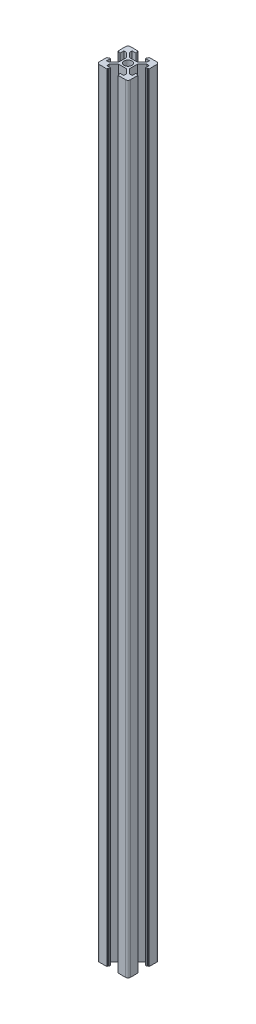
from build123d import *

# Parameters (mm, degrees)
SKETCH_1_R          = 2.5
EXTRUDE_1_DEPTH     = 500
SKETCH_2_R          = 1.75
CUT_EXTRUDE_1_DEPTH = 21


with BuildPart() as part:
    # 草图1 → 凸台-拉伸1 (new body)
    with BuildSketch(Plane(origin=(0, 0, 0), x_dir=(1, 0, 0), z_dir=(0, 1, 0))):
        with BuildLine():
            Line((-5.825824942, 5.993206118), (-5.825824942, 0.914526462))
            Line((-5.825824942, 0.914526462), (-8.786485114, -2.04613371))
            Line((-8.786485114, -2.04613371), (-10.425824942, -2.04613371))
            Line((-10.425824942, -2.04613371), (-10.425824942, 0.35386629))
            Line((-10.425824942, 0.35386629), (-11.425824942, 0.35386629))
            Line((-11.425824942, 0.35386629), (-11.425824942, -0.14613371))
            Line((-11.425824942, -0.14613371), (-12.225824942, -0.14613371))
            Line((-12.225824942, -0.14613371), (-12.225824942, -5.04613371))
            ThreePointArc((-12.225824942, -5.04613371), (-11.786485114, -6.106793882), (-10.725824942, -6.54613371))
            Line((-10.725824942, -6.54613371), (-5.825824942, -6.54613371))
            Line((-5.825824942, -6.54613371), (-5.825824942, -5.74613371))
            Line((-5.825824942, -5.74613371), (-5.325824942, -5.74613371))
            Line((-5.325824942, -5.74613371), (-5.325824942, -4.74613371))
            Line((-5.325824942, -4.74613371), (-7.725824942, -4.74613371))
            Line((-7.725824942, -4.74613371), (-7.725824942, -3.106793882))
            Line((-7.725824942, -3.106793882), (-4.765164771, -0.14613371))
            Line((-4.765164771, -0.14613371), (0.313514886, -0.14613371))
            Line((0.313514886, -0.14613371), (3.274175058, -3.106793882))
            Line((3.274175058, -3.106793882), (3.274175058, -4.74613371))
            Line((3.274175058, -4.74613371), (0.874175058, -4.74613371))
            Line((0.874175058, -4.74613371), (0.874175058, -5.74613371))
            Line((0.874175058, -5.74613371), (1.374175058, -5.74613371))
            Line((1.374175058, -5.74613371), (1.374175058, -6.54613371))
            Line((1.374175058, -6.54613371), (6.274175058, -6.54613371))
            ThreePointArc((6.274175058, -6.54613371), (7.334835229, -6.106793882), (7.774175058, -5.04613371))
            Line((7.774175058, -5.04613371), (7.774175058, -0.14613371))
            Line((7.774175058, -0.14613371), (6.974175058, -0.14613371))
            Line((6.974175058, -0.14613371), (6.974175058, 0.35386629))
            Line((6.974175058, 0.35386629), (5.974175058, 0.35386629))
            Line((5.974175058, 0.35386629), (5.974175058, -2.04613371))
            Line((5.974175058, -2.04613371), (4.334835229, -2.04613371))
            Line((4.334835229, -2.04613371), (1.374175058, 0.914526462))
            Line((1.374175058, 0.914526462), (1.374175058, 5.993206118))
            Line((1.374175058, 5.993206118), (4.334835229, 8.95386629))
            Line((4.334835229, 8.95386629), (5.974175058, 8.95386629))
            Line((5.974175058, 8.95386629), (5.974175058, 6.55386629))
            Line((5.974175058, 6.55386629), (6.974175058, 6.55386629))
            Line((6.974175058, 6.55386629), (6.974175058, 7.05386629))
            Line((6.974175058, 7.05386629), (7.774175058, 7.05386629))
            Line((7.774175058, 7.05386629), (7.774175058, 11.95386629))
            ThreePointArc((7.774175058, 11.95386629), (7.334835229, 13.014526462), (6.274175058, 13.45386629))
            Line((6.274175058, 13.45386629), (1.374175058, 13.45386629))
            Line((1.374175058, 13.45386629), (1.374175058, 12.65386629))
            Line((1.374175058, 12.65386629), (0.874175058, 12.65386629))
            Line((0.874175058, 12.65386629), (0.874175058, 11.65386629))
            Line((0.874175058, 11.65386629), (3.274175058, 11.65386629))
            Line((3.274175058, 11.65386629), (3.274175058, 10.014526462))
            Line((3.274175058, 10.014526462), (0.313514886, 7.05386629))
            Line((0.313514886, 7.05386629), (-4.765164771, 7.05386629))
            Line((-4.765164771, 7.05386629), (-7.725824942, 10.014526462))
            Line((-7.725824942, 10.014526462), (-7.725824942, 11.65386629))
            Line((-7.725824942, 11.65386629), (-5.325824942, 11.65386629))
            Line((-5.325824942, 11.65386629), (-5.325824942, 12.65386629))
            Line((-5.325824942, 12.65386629), (-5.825824942, 12.65386629))
            Line((-5.825824942, 12.65386629), (-5.825824942, 13.45386629))
            Line((-5.825824942, 13.45386629), (-10.725824942, 13.45386629))
            ThreePointArc((-10.725824942, 13.45386629), (-11.786485114, 13.014526462), (-12.225824942, 11.95386629))
            Line((-12.225824942, 11.95386629), (-12.225824942, 7.05386629))
            Line((-12.225824942, 7.05386629), (-11.425824942, 7.05386629))
            Line((-11.425824942, 7.05386629), (-11.425824942, 6.55386629))
            Line((-11.425824942, 6.55386629), (-10.425824942, 6.55386629))
            Line((-10.425824942, 6.55386629), (-10.425824942, 8.95386629))
            Line((-10.425824942, 8.95386629), (-8.786485114, 8.95386629))
            Line((-8.786485114, 8.95386629), (-5.825824942, 5.993206118))
        make_face()
        with Locations((-2.225824942, 3.45386629)):
            Circle(SKETCH_1_R, mode=Mode.SUBTRACT)
    extrude(amount=EXTRUDE_1_DEPTH)

    # 草图2 → 切除-拉伸1 (cut)
    with BuildSketch(Plane(origin=(0, 0, -7.05386629), x_dir=(-1, 0, 0), z_dir=(0, 0, -1))):
        with Locations((2.225824942, 130)):
            Circle(SKETCH_2_R)
        with Locations((2.225824942, 370)):
            Circle(SKETCH_2_R)
    extrude(amount=-CUT_EXTRUDE_1_DEPTH, mode=Mode.SUBTRACT)


solid = part.part
